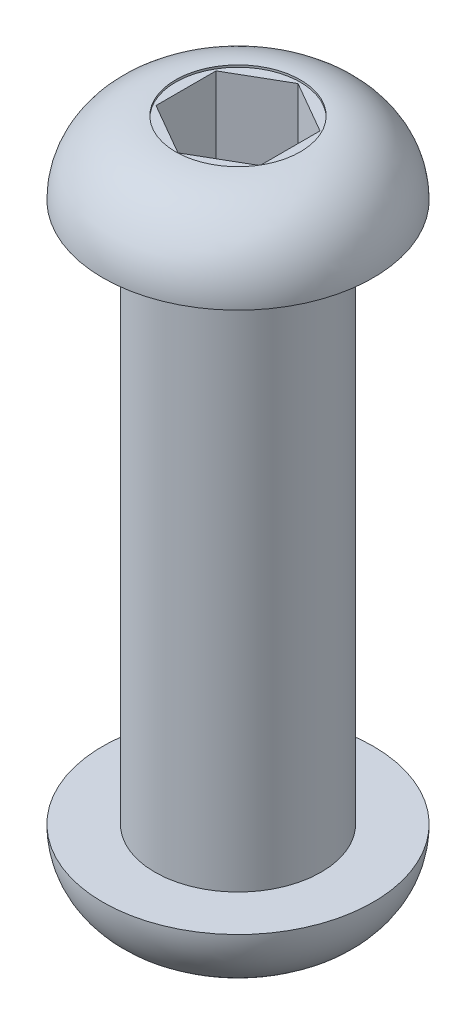
from build123d import *

# Parameters (mm, degrees)
BOSS_EXTRUDE1_DEPTH      = 1.75
BOSS_EXTRUDE1_DEPTH_BACK = 14.75
SKETCH1_R                = 3.25
FILLET1_R                = 1.75
SKETCH7_R                = 1.5
CUT_EXTRUDE2_DEPTH       = 0.05
SKETCH1_4_R              = 3.25
SKETCH1_4_R_2            = 2
CUT_EXTRUDE3_DEPTH       = 13
FILLET2_R                = 1.75
CUT_EXTRUDE4_START       = -0.05
SKETCH8_R                = 1.5
CUT_EXTRUDE4_DEPTH       = 0.05


with BuildPart() as part:
    # Sketch1 → Boss-Extrude1 (new, two sides: drawn at the far end of the back side and taken through both)
    with BuildSketch(Plane(origin=(0, 0, 0), x_dir=(1, 0, 0), z_dir=(0, 1, 0)).offset(-BOSS_EXTRUDE1_DEPTH_BACK)):
        with Locations(Location((0, 0, 0), (0, 0, 270))):
            Circle(SKETCH1_R)
        Polygon((0, 1.443375673), (-1.25, 0.721687836), (-1.25, -0.721687836), (0, -1.443375673), (1.25, -0.721687836), (1.25, 0.721687836), align=None, mode=Mode.SUBTRACT)
    extrude(amount=BOSS_EXTRUDE1_DEPTH + BOSS_EXTRUDE1_DEPTH_BACK)

    # Fillet1
    fillet1_edges = [part.edges().sort_by_distance(p)[0] for p in [
        (0, 1.75, -3.25),
    ]]
    fillet(fillet1_edges, radius=FILLET1_R - 0.0001)  # a hair under: the kernel refuses the full size

    # Sketch7 → Cut-Extrude2 (cut)
    with BuildSketch(Plane(origin=(0, 1.75, 0), x_dir=(1, 0, 0), z_dir=(0, 1, 0))):
        with Locations(Location((0, 0, 0), (0, 0, 270))):
            Circle(SKETCH7_R)
    extrude(amount=-CUT_EXTRUDE2_DEPTH, mode=Mode.SUBTRACT)

    # Sketch1<4> → Cut-Extrude3 (cut)
    with BuildSketch(Plane(origin=(0, 0, 0), x_dir=(1, 0, 0), z_dir=(0, 1, 0))):
        with Locations(Location((0, 0, 0), (0, 0, 270))):
            Circle(SKETCH1_4_R)
        with Locations(Location((0, 0, 0), (0, 0, 270))):
            Circle(SKETCH1_4_R_2, mode=Mode.SUBTRACT)
    extrude(amount=-CUT_EXTRUDE3_DEPTH, mode=Mode.SUBTRACT)

    # Fillet2
    fillet2_edges = [part.edges().sort_by_distance(p)[0] for p in [
        (0, -14.75, -3.25),
    ]]
    fillet(fillet2_edges, radius=FILLET2_R - 0.0001)  # a hair under: the kernel refuses the full size

    # Sketch8 → Cut-Extrude4 (cut)
    with BuildSketch(Plane.XZ.offset(14.75).offset(CUT_EXTRUDE4_START)):
        with Locations(Location((0, 0, 0), (0, 0, 90))):
            Circle(SKETCH8_R)
    extrude(amount=CUT_EXTRUDE4_DEPTH, mode=Mode.SUBTRACT)


solid = part.part
